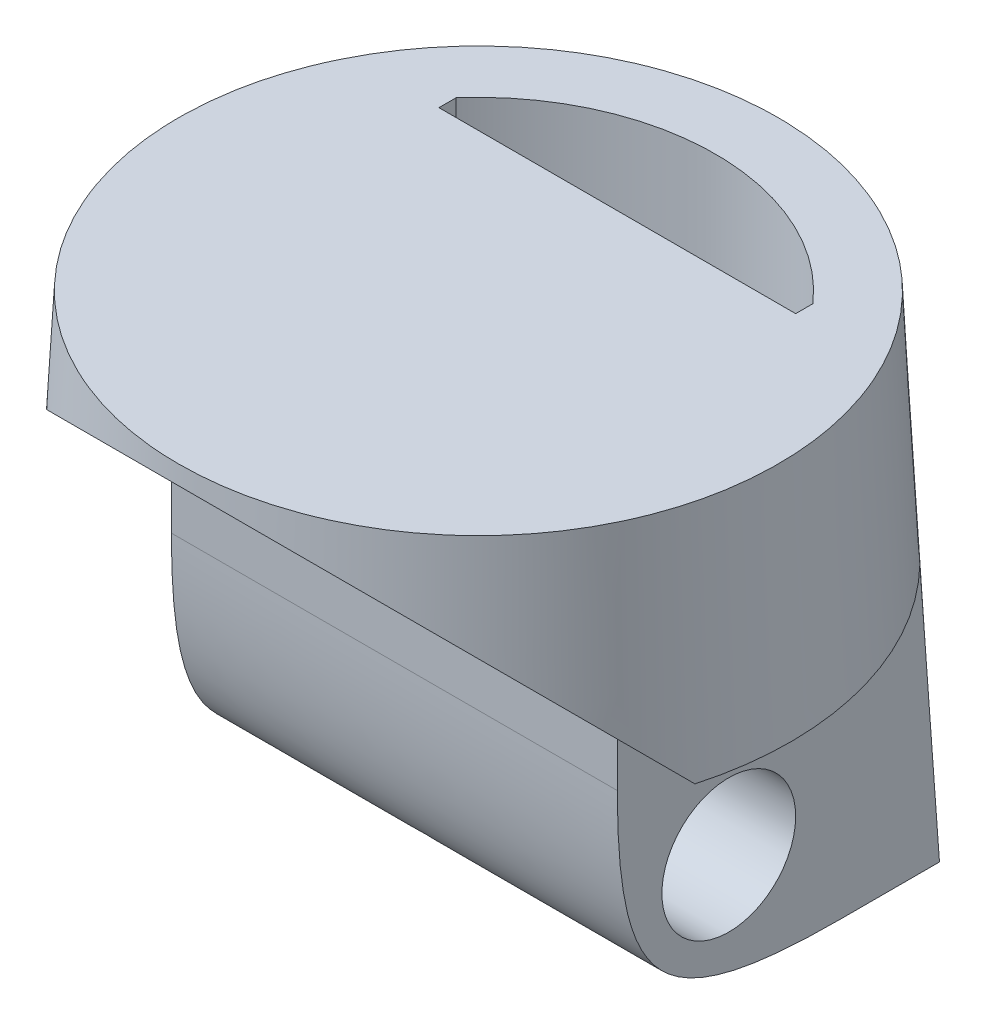
from build123d import *

# Parameters (mm, degrees)
SKETCH1_R                     = 7
BOSS_EXTRUDE1_DEPTH           = 15
BOSS_EXTRUDE1_TAPER           = 3
BOSS_EXTRUDE1_OTHER_WAY_DEPTH = 6
BOSS_EXTRUDE1_OTHER_WAY_TAPER = -3
CUT_EXTRUDE1_DEPTH            = 19.220929184
CUT_EXTRUDE1_DEPTH_BACK       = 19.220929184
CUT_EXTRUDE2_START            = -9.200504543
CUT_EXTRUDE2_OUTLINE_W        = 6.502745185
CUT_EXTRUDE2_OUTLINE_H        = 6
CUT_EXTRUDE2_DEPTH            = 9.200504543
SKETCH5_R                     = 1.5
CUT_EXTRUDE3_DEPTH            = 21.554832283
FILLET1_SIZE                  = 5
CUT_EXTRUDE4_DEPTH            = 19.096992379
CUT_EXTRUDE4_DEPTH_BACK       = 19.096992379
SKETCH6_W                     = 14.909790155
SKETCH6_H                     = 10.479187812
CUT_EXTRUDE5_DEPTH            = 16.143532008


with BuildPart() as part:
    # Sketch1 → Boss-Extrude1 (new body)
    with BuildSketch(Plane(origin=(0, 0, 0), x_dir=(1, 0, 0), z_dir=(0, 1, 0))):
        Circle(SKETCH1_R)
    extrude(amount=BOSS_EXTRUDE1_DEPTH, taper=BOSS_EXTRUDE1_TAPER)

    # Sketch1 → Boss-Extrude1 other way (add)
    with BuildSketch(Plane(origin=(0, 0, 0), x_dir=(1, 0, 0), z_dir=(0, 1, 0))):
        Circle(SKETCH1_R)
    extrude(amount=-BOSS_EXTRUDE1_OTHER_WAY_DEPTH, taper=BOSS_EXTRUDE1_OTHER_WAY_TAPER)

    # Sketch3 → Cut-Extrude1 (cut, two sides: drawn at the far end of the back side and taken through both)
    with BuildSketch(Plane(origin=(0, 0, 0), x_dir=(0, 0, -1), z_dir=(1, 0, 0)).offset(-CUT_EXTRUDE1_DEPTH_BACK)):
        Polygon((-1.886057768, -6), (-1.886057768, 0), (-9.929766736, 8.043708969), (-9.929766736, -6), align=None)
    extrude(amount=CUT_EXTRUDE1_DEPTH + CUT_EXTRUDE1_DEPTH_BACK, mode=Mode.SUBTRACT)

    # Cut-Extrude2: read off the stored shape, not the designer's step
    # Cut-Extrude2 outline → Cut-Extrude2 (cut)
    with BuildSketch(Plane.XY.offset(1.886057768).offset(CUT_EXTRUDE2_START)):
        with Locations((-8.251372593, -3)):
            Rectangle(CUT_EXTRUDE2_OUTLINE_W, CUT_EXTRUDE2_OUTLINE_H)
        with Locations((8.251372593, -3)):
            Rectangle(CUT_EXTRUDE2_OUTLINE_W, CUT_EXTRUDE2_OUTLINE_H)
    extrude(amount=CUT_EXTRUDE2_DEPTH, mode=Mode.SUBTRACT)

    # Sketch5 → Cut-Extrude3 (cut, through all)
    with BuildSketch(Plane(origin=(5, 0, 0), x_dir=(0, 0, -1), z_dir=(1, 0, 0))):
        with Locations((0.613942232, -3.5)):
            Circle(SKETCH5_R)
    extrude(amount=-CUT_EXTRUDE3_DEPTH, mode=Mode.SUBTRACT)

    # Fillet1
    # a fillet whose section is not a circle: 5 mm, written as the material it takes off along each edge
    with BuildSketch(Plane(origin=(17.5, -6, 1.886057768), x_dir=(0, 0, -1), z_dir=(-1, 0, 0))) as fillet1_piece_1:
        with BuildLine():
            Bezier((FILLET1_SIZE, 0), (0, 0), (0, -FILLET1_SIZE), weights=[1, 1.5, 1])
            Line((0, -FILLET1_SIZE), (0, 0))
            Line((0, 0), (FILLET1_SIZE, 0))
        make_face()
    extrude(amount=35, mode=Mode.SUBTRACT)

    # Fillet2
    # a fillet whose section is not a circle: 10, 5 mm, written as the material it takes off along each edge
    with BuildSketch(Plane(origin=(0, 15, 0), x_dir=(1, 0, 0), z_dir=(0, 0, -1))) as fillet2_piece_1:
        with BuildLine():
            Bezier((6.724247047, 9.738320219), (6.213883311, 0), (1.731099374, 0), weights=[1, 0.818181818, 1])
            Line((1.731099374, 0), (6.213883311, 0))
            Line((6.213883311, 0), (6.724247047, 9.738320219))
        make_face()
    revolve(axis=Axis((0, 15, 0), (0, -1, 0)), mode=Mode.SUBTRACT)

    # Sketch6 → Cut-Extrude4 (cut, two sides: drawn at the far end of the back side and taken through both)
    with BuildSketch(Plane(origin=(0, 0, 0), x_dir=(0, 0, -1), z_dir=(1, 0, 0)).offset(-CUT_EXTRUDE4_DEPTH_BACK)):
        with Locations((0.730648031, 10.501273687)):
            Rectangle(SKETCH6_W, SKETCH6_H)
    extrude(amount=CUT_EXTRUDE4_DEPTH + CUT_EXTRUDE4_DEPTH_BACK, mode=Mode.SUBTRACT)

    # Sketch7 → Cut-Extrude5 (cut, through all)
    with BuildSketch(Plane.XZ.offset(6)):
        with BuildLine():
            Line((4, -3.113942232), (4, -3.499048938))
            ThreePointArc((4, -3.499048938), (0, -5.314446676), (-4, -3.499048938))
            Line((-4, -3.499048938), (-4, -3.113942232))
            Line((-4, -3.113942232), (4, -3.113942232))
        make_face()
    extrude(amount=-CUT_EXTRUDE5_DEPTH, mode=Mode.SUBTRACT)


solid = part.part
